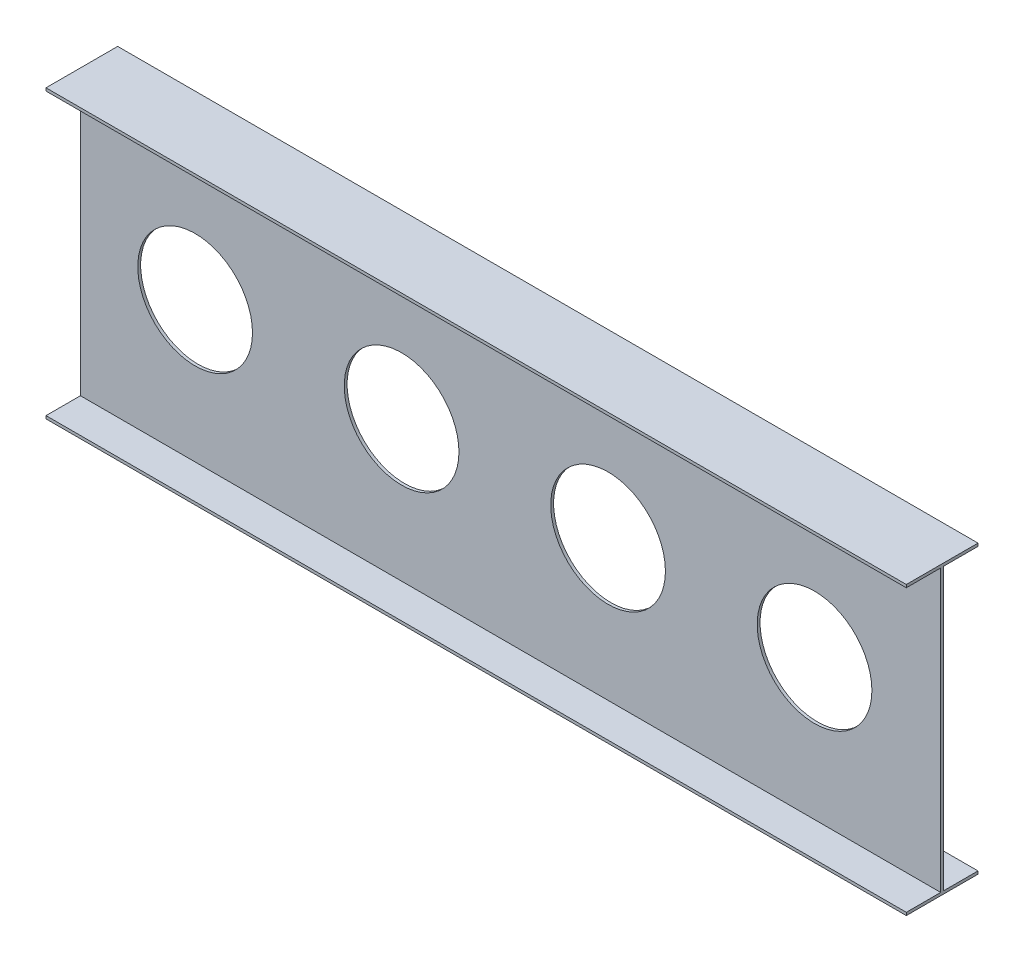
from build123d import *

# Parameters (mm, degrees)
BOSS_EXTRUDE1_DEPTH = 3000
SKETCH2_R           = 200
CUT_EXTRUDE1_DEPTH  = 3155.406541225


with BuildPart() as part:
    # Sketch1 → Boss-Extrude1 (new body)
    with BuildSketch(Plane(origin=(0, 0, 0), x_dir=(0, 0, -1), z_dir=(1, 0, 0))):
        Polygon((-4.58433585, -956.116259735), (115.41566415, -956.116259735), (115.41566415, -966.116259735), (-134.58433585, -966.116259735), (-134.58433585, -956.116259735), (-14.58433585, -956.116259735), (-14.58433585, 23.883740265), (-134.58433585, 23.883740265), (-134.58433585, 33.883740265), (115.41566415, 33.883740265), (115.41566415, 23.883740265), (-4.58433585, 23.883740265), align=None)
    extrude(amount=BOSS_EXTRUDE1_DEPTH)

    # Sketch2 → Cut-Extrude1 (cut, through all)
    with BuildSketch(Plane.XY.offset(14.58433585)):
        with Locations((400, -466.116259735)):
            Circle(SKETCH2_R)
        with Locations((1120, -466.116259735)):
            Circle(SKETCH2_R)
        with Locations((1840, -466.116259735)):
            Circle(SKETCH2_R)
        with Locations((2560, -466.116259735)):
            Circle(SKETCH2_R)
    extrude(amount=-CUT_EXTRUDE1_DEPTH, mode=Mode.SUBTRACT)


solid = part.part
